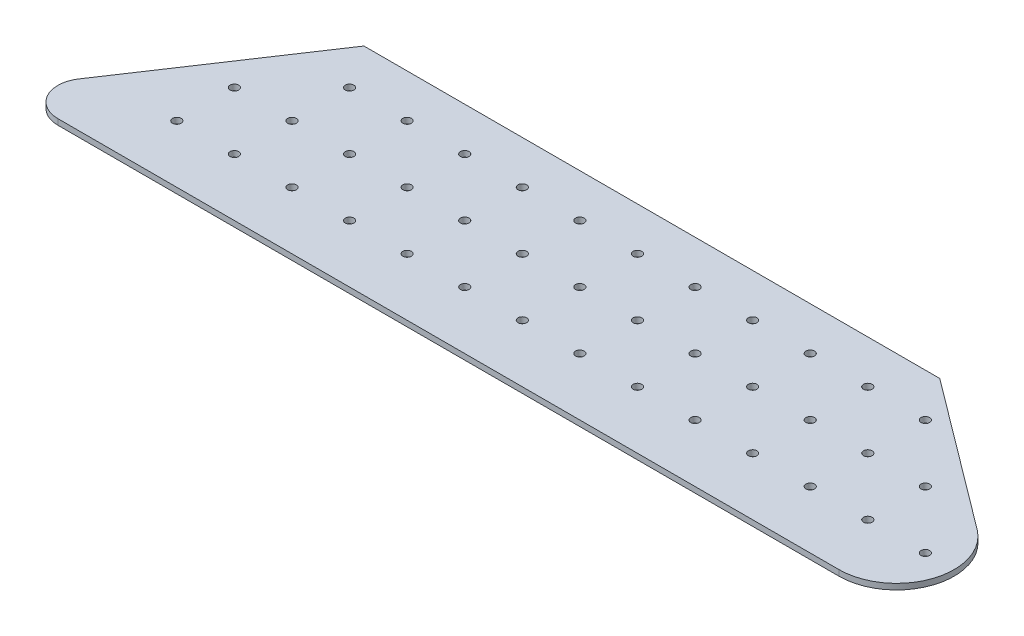
from build123d import *

# Parameters (mm, degrees)
SKETCH1_R           = 1.5
BOSS_EXTRUDE1_DEPTH = 2
FILLET4_R           = 20
FILLET5_R           = 10


with BuildPart() as part:
    # Sketch1 → Boss-Extrude1 (new body)
    with BuildSketch(Plane(origin=(0, 0, 0), x_dir=(1, 0, 0), z_dir=(0, 1, 0))):
        Polygon((-17.984046201, 0), (332.015953799, 0), (232.015953799, 75), (32.015953799, 75), align=None)
        with Locations((42.015953799, 20)):
            Circle(SKETCH1_R, mode=Mode.SUBTRACT)
        with Locations((62.015953799, 20)):
            Circle(SKETCH1_R, mode=Mode.SUBTRACT)
        with Locations((82.015953799, 20)):
            Circle(SKETCH1_R, mode=Mode.SUBTRACT)
        with Locations((102.015953799, 20)):
            Circle(SKETCH1_R, mode=Mode.SUBTRACT)
        with Locations((122.015953799, 20)):
            Circle(SKETCH1_R, mode=Mode.SUBTRACT)
        with Locations((22.015953799, 20)):
            Circle(SKETCH1_R, mode=Mode.SUBTRACT)
        with Locations((162.015953799, 20)):
            Circle(SKETCH1_R, mode=Mode.SUBTRACT)
        with Locations((182.015953799, 20)):
            Circle(SKETCH1_R, mode=Mode.SUBTRACT)
        with Locations((202.015953799, 20)):
            Circle(SKETCH1_R, mode=Mode.SUBTRACT)
        with Locations((222.015953799, 20)):
            Circle(SKETCH1_R, mode=Mode.SUBTRACT)
        with Locations((242.015953799, 20)):
            Circle(SKETCH1_R, mode=Mode.SUBTRACT)
        with Locations((142.015953799, 20)):
            Circle(SKETCH1_R, mode=Mode.SUBTRACT)
        with Locations((242.015953799, 60)):
            Circle(SKETCH1_R, mode=Mode.SUBTRACT)
        with Locations((222.015953799, 60)):
            Circle(SKETCH1_R, mode=Mode.SUBTRACT)
        with Locations((202.015953799, 60)):
            Circle(SKETCH1_R, mode=Mode.SUBTRACT)
        with Locations((182.015953799, 60)):
            Circle(SKETCH1_R, mode=Mode.SUBTRACT)
        with Locations((162.015953799, 60)):
            Circle(SKETCH1_R, mode=Mode.SUBTRACT)
        with Locations((142.015953799, 60)):
            Circle(SKETCH1_R, mode=Mode.SUBTRACT)
        with Locations((122.015953799, 60)):
            Circle(SKETCH1_R, mode=Mode.SUBTRACT)
        with Locations((102.015953799, 60)):
            Circle(SKETCH1_R, mode=Mode.SUBTRACT)
        with Locations((82.015953799, 60)):
            Circle(SKETCH1_R, mode=Mode.SUBTRACT)
        with Locations((62.015953799, 60)):
            Circle(SKETCH1_R, mode=Mode.SUBTRACT)
        with Locations((42.015953799, 60)):
            Circle(SKETCH1_R, mode=Mode.SUBTRACT)
        with Locations((282.015953799, 20)):
            Circle(SKETCH1_R, mode=Mode.SUBTRACT)
        with Locations((262.015953799, 20)):
            Circle(SKETCH1_R, mode=Mode.SUBTRACT)
        with Locations((262.015953799, 40)):
            Circle(SKETCH1_R, mode=Mode.SUBTRACT)
        with Locations((242.015953799, 40)):
            Circle(SKETCH1_R, mode=Mode.SUBTRACT)
        with Locations((202.015953799, 40)):
            Circle(SKETCH1_R, mode=Mode.SUBTRACT)
        with Locations((182.015953799, 40)):
            Circle(SKETCH1_R, mode=Mode.SUBTRACT)
        with Locations((162.015953799, 40)):
            Circle(SKETCH1_R, mode=Mode.SUBTRACT)
        with Locations((142.015953799, 40)):
            Circle(SKETCH1_R, mode=Mode.SUBTRACT)
        with Locations((122.015953799, 40)):
            Circle(SKETCH1_R, mode=Mode.SUBTRACT)
        with Locations((102.015953799, 40)):
            Circle(SKETCH1_R, mode=Mode.SUBTRACT)
        with Locations((82.015953799, 40)):
            Circle(SKETCH1_R, mode=Mode.SUBTRACT)
        with Locations((62.015953799, 40)):
            Circle(SKETCH1_R, mode=Mode.SUBTRACT)
        with Locations((42.015953799, 40)):
            Circle(SKETCH1_R, mode=Mode.SUBTRACT)
        with Locations((22.015953799, 40)):
            Circle(SKETCH1_R, mode=Mode.SUBTRACT)
        with Locations((222.015953799, 40)):
            Circle(SKETCH1_R, mode=Mode.SUBTRACT)
    extrude(amount=BOSS_EXTRUDE1_DEPTH)

    # Fillet4
    fillet4_edges = [part.edges().sort_by_distance(p)[0] for p in [
        (332.015953799, 1, 0),
    ]]
    fillet(fillet4_edges, radius=FILLET4_R)

    # Fillet5
    fillet5_edges = [part.edges().sort_by_distance(p)[0] for p in [
        (-17.984046201, 1, 0),
    ]]
    fillet(fillet5_edges, radius=FILLET5_R)


solid = part.part
